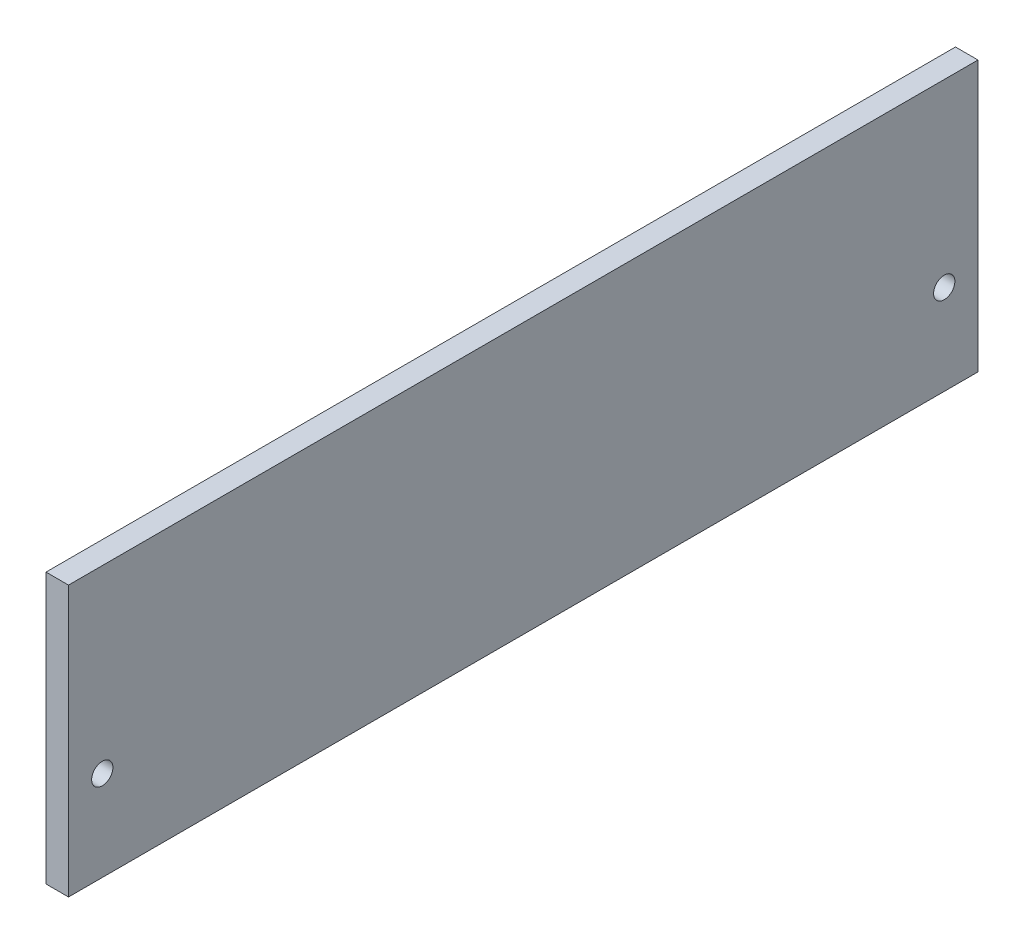
from build123d import *

# Parameters (mm, degrees)
SKETCH1_W           = 128.27
SKETCH1_H           = 38.1
SKETCH1_R           = 1.5
BOSS_EXTRUDE1_DEPTH = 3.175


with BuildPart() as part:
    # Sketch1 → Boss-Extrude1 (new body)
    with BuildSketch(Plane(origin=(0, 0, 0), x_dir=(0, 0, -1), z_dir=(1, 0, 0))):
        Rectangle(SKETCH1_W, SKETCH1_H)
        with Locations((-59.3725, -6.35)):
            Circle(SKETCH1_R, mode=Mode.SUBTRACT)
        with Locations((59.3725, -6.35)):
            Circle(SKETCH1_R, mode=Mode.SUBTRACT)
    extrude(amount=BOSS_EXTRUDE1_DEPTH)


solid = part.part
